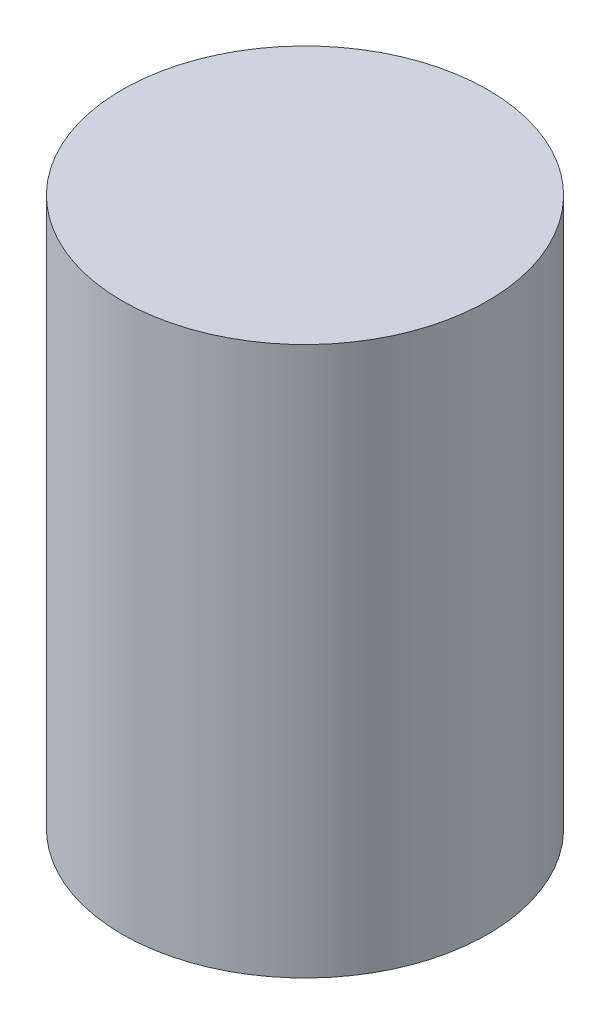
from build123d import *

# Parameters (mm, degrees)
SKETCH1_R           = 1
BOSS_EXTRUDE1_DEPTH = 3


with BuildPart() as part:
    # Sketch1 → Boss-Extrude1 (new body)
    with BuildSketch(Plane(origin=(0, 0, 0), x_dir=(1, 0, 0), z_dir=(0, 1, 0))):
        Circle(SKETCH1_R)
    extrude(amount=BOSS_EXTRUDE1_DEPTH)


solid = part.part
